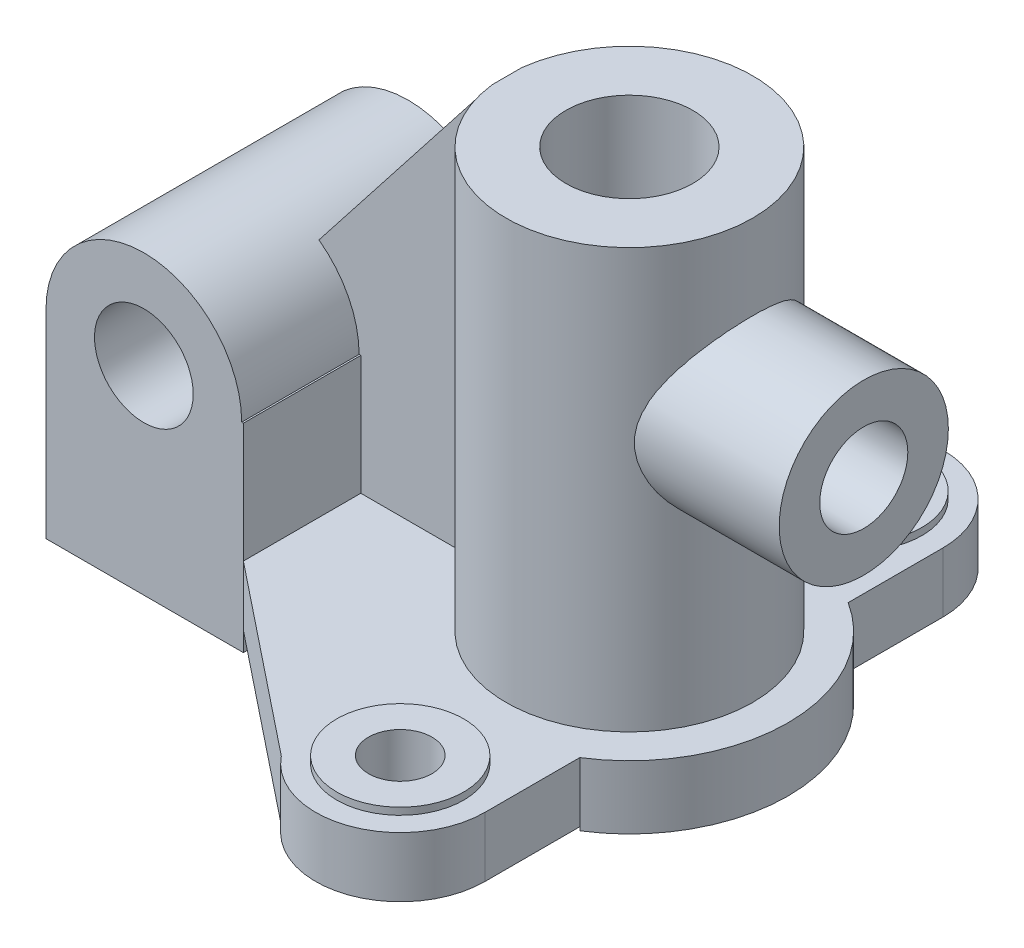
from build123d import *

# Parameters (mm, degrees)
BOSS_EXTRUDE1_DEPTH  = 17
SKETCH2_W            = 56
SKETCH2_H            = 75
BOSS_EXTRUDE2_DEPTH  = 22.5
SKETCH3_R            = 18
BOSS_EXTRUDE3_DEPTH  = 2
SKETCH5_R            = 18
BOSS_EXTRUDE4_DEPTH  = 2
SKETCH6_R            = 9
CUT_EXTRUDE1_DEPTH   = 60
SKETCH7_R            = 9
CUT_EXTRUDE2_DEPTH   = 60
BOSS_EXTRUDE5_DEPTH  = 18
SKETCH11_R           = 35
BOSS_EXTRUDE6_DEPTH  = 119
SKETCH12_R           = 18
CUT_EXTRUDE3_DEPTH   = 119
SKETCH16_R           = 24
BOSS_EXTRUDE9_DEPTH  = 31.5
SKETCH17_R           = 12.5
CUT_EXTRUDE4_DEPTH   = 23
SKETCH22_W           = 93.274723346
SKETCH22_H           = 8.564066864
BOSS_EXTRUDE10_DEPTH = 119
CUT_EXTRUDE6_DEPTH   = 119
SKETCH24_W           = 55.520334401
SKETCH24_H           = 17.140543773
BOSS_EXTRUDE11_DEPTH = 1
BOSS_EXTRUDE12_DEPTH = 75
SKETCH28_W           = 56
SKETCH28_H           = 75
BOSS_EXTRUDE13_DEPTH = 47
SKETCH29_R           = 14
CUT_EXTRUDE7_DEPTH   = 120


with BuildPart() as part:
    # Sketch1 → Boss-Extrude1 (new body)
    with BuildSketch(Plane(origin=(0, 0, 0), x_dir=(1, 0, 0), z_dir=(0, 1, 0))):
        with BuildLine():
            Line((-28, 37.5), (28, 37.5))
            Line((28, 37.5), (84.880924764, 83.639033344))
            ThreePointArc((84.880924764, 83.639033344), (110.323327815, 86.666308011), (124, 65))
            Line((124, 65), (124, -65))
            ThreePointArc((124, -65), (107.972859878, -87.636994177), (81.297207887, -80.040131887))
            Line((81.297207887, -80.040131887), (28, -37.5))
            Line((28, -37.5), (-28, -37.5))
            Line((-28, -37.5), (-28, 37.5))
        make_face()
    extrude(amount=BOSS_EXTRUDE1_DEPTH)

    # Sketch2 → Boss-Extrude2 (add)
    with BuildSketch(Plane(origin=(0, 17, 0), x_dir=(1, 0, 0), z_dir=(0, 1, 0))):
        Rectangle(SKETCH2_W, SKETCH2_H)
    extrude(amount=-BOSS_EXTRUDE2_DEPTH)

    # Sketch3 → Boss-Extrude3 (add)
    with BuildSketch(Plane(origin=(0, 17, 0), x_dir=(1, 0, 0), z_dir=(0, 1, 0))):
        with Locations((100, 65)):
            Circle(SKETCH3_R)
    extrude(amount=BOSS_EXTRUDE3_DEPTH)

    # Sketch5 → Boss-Extrude4 (add)
    with BuildSketch(Plane(origin=(0, 17, 0), x_dir=(1, 0, 0), z_dir=(0, 1, 0))):
        with Locations((100, -65)):
            Circle(SKETCH5_R)
    extrude(amount=BOSS_EXTRUDE4_DEPTH)

    # Sketch6 → Cut-Extrude1 (cut)
    with BuildSketch(Plane(origin=(0, 19, 0), x_dir=(1, 0, 0), z_dir=(0, 1, 0))):
        with Locations((100, -65)):
            Circle(SKETCH6_R)
    extrude(amount=-CUT_EXTRUDE1_DEPTH, mode=Mode.SUBTRACT)

    # Sketch7 → Cut-Extrude2 (cut)
    with BuildSketch(Plane(origin=(0, 19, 0), x_dir=(1, 0, 0), z_dir=(0, 1, 0))):
        with Locations((100, 65)):
            Circle(SKETCH7_R)
    extrude(amount=-CUT_EXTRUDE2_DEPTH, mode=Mode.SUBTRACT)

    # Sketch10 → Boss-Extrude5 (add)
    with BuildSketch(Plane(origin=(0, 17, 0), x_dir=(1, 0, 0), z_dir=(0, 1, 0))):
        with BuildLine():
            Line((124, 38.065732621), (124, -38.065732621))
            ThreePointArc((124, -38.065732621), (145, 0), (124, 38.065732621))
        make_face()
    extrude(amount=-BOSS_EXTRUDE5_DEPTH)

    # Sketch11 → Boss-Extrude6 (add)
    with BuildSketch(Plane(origin=(0, 17, 0), x_dir=(1, 0, 0), z_dir=(0, 1, 0))):
        with Locations((100, 0)):
            Circle(SKETCH11_R)
    extrude(amount=BOSS_EXTRUDE6_DEPTH)

    # Sketch12 → Cut-Extrude3 (cut)
    with BuildSketch(Plane(origin=(0, 136, 0), x_dir=(1, 0, 0), z_dir=(0, 1, 0))):
        with Locations((100, 0)):
            Circle(SKETCH12_R)
    extrude(amount=-CUT_EXTRUDE3_DEPTH, mode=Mode.SUBTRACT)

    # Sketch22 → Boss-Extrude10 (add)
    with BuildSketch(Plane(origin=(0, 17, 0), x_dir=(1, 0, 0), z_dir=(0, 1, 0))):
        with Locations((18.637361673, 0.094627541)):
            Rectangle(SKETCH22_W, SKETCH22_H)
    extrude(amount=BOSS_EXTRUDE10_DEPTH)

    # Sketch23 → Cut-Extrude6 (cut)
    with BuildSketch(Plane.XY.offset(4.187405891)):
        Polygon((-28, 17), (65.251393813, 136), (-28, 136), align=None)
    extrude(amount=-CUT_EXTRUDE6_DEPTH, mode=Mode.SUBTRACT)

    # Sketch24 → Boss-Extrude11 (add)
    with BuildSketch(Plane(origin=(0, 17, 0), x_dir=(1, 0, 0), z_dir=(0, 1, 0))):
        with Locations((-0.239832799, -28.929728114)):
            Rectangle(SKETCH24_W, SKETCH24_H)
    extrude(amount=BOSS_EXTRUDE11_DEPTH)

    # Sketch25 → Boss-Extrude12 (add)
    with BuildSketch(Plane.XY.offset(37.5)):
        with BuildLine():
            Line((-28, 50.883044326), (27.520334401, 50.883044326))
            ThreePointArc((27.520334401, 50.883044326), (-0.2398328, 78.643211526), (-28, 50.883044326))
        make_face()
    extrude(amount=-BOSS_EXTRUDE12_DEPTH)

    # Sketch28 → Boss-Extrude13 (add)
    with BuildSketch(Plane.XZ.offset(-50.883044326)):
        Rectangle(SKETCH28_W, SKETCH28_H)
    extrude(amount=BOSS_EXTRUDE13_DEPTH)

    # Sketch29 → Cut-Extrude7 (cut)
    with BuildSketch(Plane.XY.offset(37.5)):
        with Locations((-0.2398328, 50.883044326)):
            Circle(SKETCH29_R)
    extrude(amount=-CUT_EXTRUDE7_DEPTH, mode=Mode.SUBTRACT)


with BuildPart() as body_2:
    # Sketch16 → Boss-Extrude9 (new, symmetric)
    with BuildSketch(Plane(origin=(135, 136, 0), x_dir=(0, 0, -1), z_dir=(1, 0, 0))):
        with Locations((0, -48)):
            Circle(SKETCH16_R)
    extrude(amount=BOSS_EXTRUDE9_DEPTH, both=True)

    # Sketch17 → Cut-Extrude4 (cut)
    with BuildSketch(Plane(origin=(166.5, 0, 0), x_dir=(0, 0, -1), z_dir=(1, 0, 0))):
        with Locations((0, 88)):
            Circle(SKETCH17_R)
    extrude(amount=-CUT_EXTRUDE4_DEPTH, mode=Mode.SUBTRACT)


solid = Compound([part.part, body_2.part])
